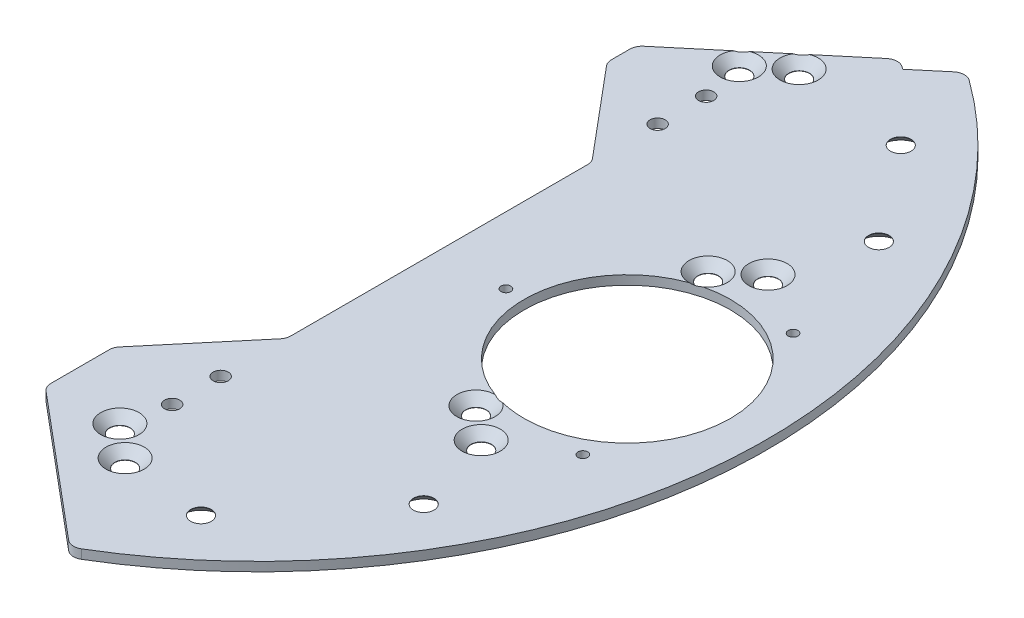
from build123d import *

# Parameters (mm, degrees)
RESSALTO_EXTRUS_O1_DEPTH                           = 1.5
ESBO_O2_R                                          = 17
CORTE_EXTRUS_O1_DEPTH                              = 122.865704774
FURO_ROSCADO_DE_M21_D                              = 1.6
CORTE_EXTRUS_O2_DEPTH                              = 2.5
ESCAREADO_PARA_PARAFUSO_COM_CABE_A_E_2_COUNT       = 2
ESCAREADO_PARA_PARAFUSO_COM_CABE_A_E_2_PITCH       = 7
ESCAREADO_PARA_PARAFUSO_COM_CABE_A_E_3_COUNT       = 2
ESCAREADO_PARA_PARAFUSO_COM_CABE_A_E_3_PITCH       = 41.65
ESCAREADO_PARA_PARAFUSO_COM_CABE_A_E_4_COUNT       = 2
ESCAREADO_PARA_PARAFUSO_COM_CABE_A_E_4_PITCH       = 42.234139035
ESCAREADO_PARA_PARAFUSO_COM_CABE_A_E_5_A_COUNT     = 2
ESCAREADO_PARA_PARAFUSO_COM_CABE_A_E_5_A_PITCH     = 7
ESCAREADO_PARA_PARAFUSO_COM_CABE_A_E_6_COUNT       = 2
ESCAREADO_PARA_PARAFUSO_COM_CABE_A_E_6_PITCH       = 41.65
ESCAREADO_PARA_PARAFUSO_COM_CABE_A_E_7_COUNT       = 2
ESCAREADO_PARA_PARAFUSO_COM_CABE_A_E_7_PITCH       = 42.234139035
ESCAREADO_PARA_PARAFUSO_COM_CABE_A_E_8_D           = 3.4
ESCAREADO_PARA_PARAFUSO_COM_CABE_A_E_8_DEPTH       = 7.25
ESCAREADO_PARA_PARAFUSO_COM_CABE_A_E_8_CSINK_D     = 6.3
ESCAREADO_PARA_PARAFUSO_COM_CABE_A_E_8_CSINK_ANGLE = 90
ESCAREADO_PARA_PARAFUSO_COM_CABE_A_E_8_TIP         = 1.021463052
CORTE_EXTRUS_O3_DEPTH                              = 122.865704775
CORTE_EXTRUS_O4_DEPTH                              = 122.865704775
CORTE_EXTRUS_O5_DEPTH                              = 115.773877222
CORTE_EXTRUS_O6_DEPTH                              = 112.164853797
FILETE2_R                                          = 2
BROCA_DE_ROSQUEAR_PARA_TARRAXA_DE_M31_D            = 2.5


with BuildPart() as part:
    # Esboço1 → Ressalto-extrusão1 (new body)
    with BuildSketch(Plane(origin=(0, 0, 0), x_dir=(1, 0, 0), z_dir=(0, 1, 0))):
        with BuildLine():
            Line((17, -85.322916031), (17, 85.322916031))
            ThreePointArc((17, 85.322916031), (87, 0), (17, -85.322916031))
        make_face()
    extrude(amount=RESSALTO_EXTRUS_O1_DEPTH)

    # Esboço2 → Corte-extrusão1 (cut, through all)
    with BuildSketch(Plane(origin=(0, 1.5, 0), x_dir=(1, 0, 0), z_dir=(0, 1, 0))):
        with Locations(Location((61, 0, 0), (0, 0, 270))):
            Circle(ESBO_O2_R)
    extrude(amount=-CORTE_EXTRUS_O1_DEPTH, mode=Mode.SUBTRACT)

    # Furo roscado de M21 (through all)
    with Locations(Plane(origin=(71, 1.5, 17.320508076), x_dir=(0, 0, 1), z_dir=(0, 1, 0))):
        with Locations((0, 0), (-17.320508076, -30), (-34.641016152, 0)):
            Hole(FURO_ROSCADO_DE_M21_D / 2)

    # Esboço4 → Corte-extrusão2 (cut)
    with BuildSketch(Plane(origin=(0, 1.5, 0), x_dir=(1, 0, 0), z_dir=(0, 1, 0))):
        with BuildLine():
            Line((30, 0), (30, 24.445048467))
            ThreePointArc((30, 24.445048467), (29.879385242, 25.129088753), (29.532088886, 25.730623686))
            Line((29.532088886, 25.730623686), (17, 40.665785639))
            Line((17, 40.665785639), (17, -40.665785639))
            Line((17, -40.665785639), (29.532088886, -25.730623686))
            ThreePointArc((29.532088886, -25.730623686), (29.879385242, -25.129088753), (30, -24.445048467))
            Line((30, -24.445048467), (30, 0))
        make_face()
    extrude(amount=-CORTE_EXTRUS_O2_DEPTH, mode=Mode.SUBTRACT)

    # Esboço6 → Escareado para parafuso com cabe_a escar (revolve, cut)
    with BuildSketch(Plane(origin=(33.786228885, 1.5, -55.535118997), x_dir=(0, 0, 1), z_dir=(1, 0, 0))):
        Polygon((0, 0), (0, 1.5), (1.7, 1.5), (1.7, 1.45), (3.15, 0), align=None)
    escareado_para_parafuso_com_cabe_a_escar = revolve(axis=Axis((33.786228885, 7.85, -55.535118997), (0, -1, 0)), mode=Mode.SUBTRACT)

    # Escareado para parafuso com cabe_a e 2: Escareado para parafuso com cabe_a escar ×2
    with Locations(*[Vector(-0.7660444431189771, 0, 0.6427876096865406) * (i * ESCAREADO_PARA_PARAFUSO_COM_CABE_A_E_2_PITCH) for i in range(1, ESCAREADO_PARA_PARAFUSO_COM_CABE_A_E_2_COUNT)]):
        add(escareado_para_parafuso_com_cabe_a_escar, mode=Mode.SUBTRACT)

    # Escareado para parafuso com cabe_a e 3: Escareado para parafuso com cabe_a escar ×2
    with Locations(*[Vector(0.642787609686541, 0, 0.7660444431189767) * (i * ESCAREADO_PARA_PARAFUSO_COM_CABE_A_E_3_PITCH) for i in range(1, ESCAREADO_PARA_PARAFUSO_COM_CABE_A_E_3_COUNT)]):
        add(escareado_para_parafuso_com_cabe_a_escar, mode=Mode.SUBTRACT)

    # Escareado para parafuso com cabe_a e 4: Escareado para parafuso com cabe_a escar ×2
    with Locations(*[Vector(0.5069309646406032, 0, 0.8619866571406704) * (i * ESCAREADO_PARA_PARAFUSO_COM_CABE_A_E_4_PITCH) for i in range(1, ESCAREADO_PARA_PARAFUSO_COM_CABE_A_E_4_COUNT)]):
        add(escareado_para_parafuso_com_cabe_a_escar, mode=Mode.SUBTRACT)

    # Esboço7 → Escareado para parafuso com cabe_a e 5 (revolve, cut)
    with BuildSketch(Plane(origin=(55.196021727, 1.5, 19.129854673), x_dir=(0, 0, 1), z_dir=(1, 0, 0))):
        Polygon((0, 0), (0, 1.5), (1.7, 1.5), (1.7, 1.45), (3.15, 0), align=None)
    escareado_para_parafuso_com_cabe_a_e_5 = revolve(axis=Axis((55.196021727, 7.85, 19.129854673), (0, -1, 0)), mode=Mode.SUBTRACT)

    # Escareado para parafuso com cabe_a e 5 a: Escareado para parafuso com cabe_a e 5 ×2
    with Locations(*[Vector(0.7660444431189781, 0, 0.6427876096865394) * (i * ESCAREADO_PARA_PARAFUSO_COM_CABE_A_E_5_A_PITCH) for i in range(1, ESCAREADO_PARA_PARAFUSO_COM_CABE_A_E_5_A_COUNT)]):
        add(escareado_para_parafuso_com_cabe_a_e_5, mode=Mode.SUBTRACT)

    # Escareado para parafuso com cabe_a e 6: Escareado para parafuso com cabe_a e 5 ×2
    with Locations(*[Vector(-0.64278760968654, 0, 0.7660444431189776) * (i * ESCAREADO_PARA_PARAFUSO_COM_CABE_A_E_6_PITCH) for i in range(1, ESCAREADO_PARA_PARAFUSO_COM_CABE_A_E_6_COUNT)]):
        add(escareado_para_parafuso_com_cabe_a_e_5, mode=Mode.SUBTRACT)

    # Escareado para parafuso com cabe_a e 7: Escareado para parafuso com cabe_a e 5 ×2
    with Locations(*[Vector(-0.5069309646406018, 0, 0.8619866571406711) * (i * ESCAREADO_PARA_PARAFUSO_COM_CABE_A_E_7_PITCH) for i in range(1, ESCAREADO_PARA_PARAFUSO_COM_CABE_A_E_7_COUNT)]):
        add(escareado_para_parafuso_com_cabe_a_e_5, mode=Mode.SUBTRACT)

    # Escareado para parafuso com cabe_a e 8
    with Locations(Plane(origin=(48.209070726, 0, 57.453333234), x_dir=(0, 0, -1), z_dir=(0, -1, 0))):
        with Locations((0, 0), (19.953333234, 16.742834558), (94.953333234, 16.742834558), (110.486341823, 4.823937863)):
            CounterSinkHole(ESCAREADO_PARA_PARAFUSO_COM_CABE_A_E_8_D / 2, ESCAREADO_PARA_PARAFUSO_COM_CABE_A_E_8_CSINK_D / 2, depth=ESCAREADO_PARA_PARAFUSO_COM_CABE_A_E_8_DEPTH, counter_sink_angle=ESCAREADO_PARA_PARAFUSO_COM_CABE_A_E_8_CSINK_ANGLE)
            with Locations((0, 0, -(ESCAREADO_PARA_PARAFUSO_COM_CABE_A_E_8_DEPTH + ESCAREADO_PARA_PARAFUSO_COM_CABE_A_E_8_TIP / 2))):  # 118° drill point
                Cone(0, ESCAREADO_PARA_PARAFUSO_COM_CABE_A_E_8_D / 2, ESCAREADO_PARA_PARAFUSO_COM_CABE_A_E_8_TIP, mode=Mode.SUBTRACT)

    # Esboço17 → Corte-extrusão3 (cut, through all)
    with BuildSketch(Plane.XZ):
        Polygon((26.495554955, -53.333739059), (17, -45.366022398), (17, -85.322916031), (48.78373029, -85.322916031), (48.78373029, -72.035738762), align=None)
    extrude(amount=-CORTE_EXTRUS_O3_DEPTH, mode=Mode.SUBTRACT)

    # Esboço18 → Corte-extrusão4 (cut, through all)
    with BuildSketch(Plane(origin=(0, 1.5, 0), x_dir=(1, 0, 0), z_dir=(0, 1, 0))):
        Polygon((23.281616906, -57.163961274), (17, -51.893058845), (17, -85.322916031), (56.840152401, -85.322916031), align=None)
    extrude(amount=-CORTE_EXTRUS_O4_DEPTH, mode=Mode.SUBTRACT)

    # Esboço19 → Corte-extrusão5 (cut, through all)
    with BuildSketch(Plane(origin=(0, 1.5, 0), x_dir=(1, 0, 0), z_dir=(0, 1, 0))):
        with BuildLine():
            Line((48.78373029, 72.035738762), (46.390783088, 70.027817648))
            ThreePointArc((46.390783088, 70.027817648), (83.958731282, -2.632763095), (41.91211377, -72.796804321))
            Line((41.91211377, -72.796804321), (44.35320854, -74.845126042))
            ThreePointArc((44.35320854, -74.845126042), (86.960447647, -2.623079291), (48.78373029, 72.035738762))
        make_face()
    extrude(amount=-CORTE_EXTRUS_O5_DEPTH, mode=Mode.SUBTRACT)

    # Esboço20 → Corte-extrusão6 (cut, through all)
    with BuildSketch(Plane(origin=(0, 1.5, 0), x_dir=(1, 0, 0), z_dir=(0, 1, 0))):
        Polygon((41.028471986, 65.52830438), (42.314047206, 63.996215494), (48.108978901, 68.858740542), (46.823403682, 70.390829428), align=None)
    extrude(amount=-CORTE_EXTRUS_O6_DEPTH, mode=Mode.SUBTRACT)

    # Filete2
    filete2_edges = [part.edges().sort_by_distance(p)[0] for p in [
        (17, 0.75, 40.665785639),
        (17, 0.75, 51.893058845),
        (41.91211377, 0.75, 72.796804321),
        (48.108978901, 0.75, -68.858740542),
        (41.028471986, 0.75, -65.52830438),
        (17, 0.75, -40.665785639),
        (17, 0.75, -45.366022398),
    ]]
    fillet(filete2_edges, radius=FILETE2_R - 0.0001)  # a hair under: the kernel refuses the full size

    # Broca de rosquear para tarraxa de M31 (through all)
    with Locations(Plane(origin=(30, 1.5, 44), x_dir=(0, 0, 1), z_dir=(0, 1, 0))):
        with Locations((0, 0), (-8, 0), (-88, 0), (-80, 0)):
            Hole(BROCA_DE_ROSQUEAR_PARA_TARRAXA_DE_M31_D / 2)


solid = part.part
